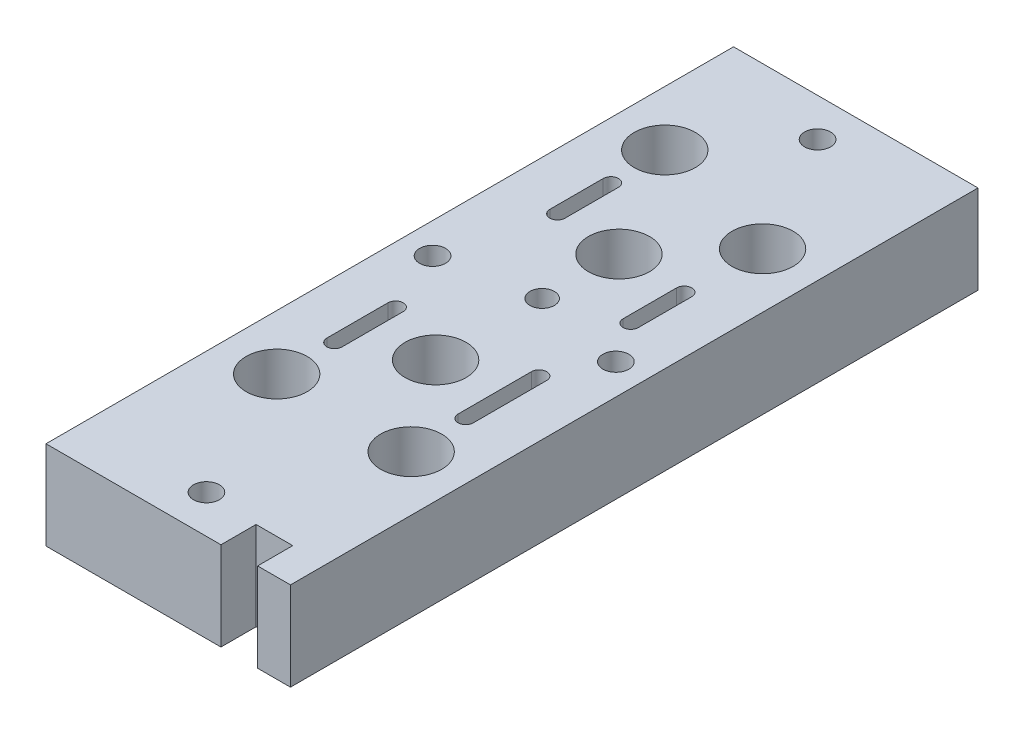
from build123d import *

# Parameters (mm, degrees)
SKETCH1_W           = 80
SKETCH1_H           = 225
BOSS_EXTRUDE1_DEPTH = 29
CUT_EXTRUDE1_REACH  = 124.871
SKETCH4_R           = 10
CUT_EXTRUDE2_DEPTH  = 17
SKETCH5_R           = 8.5
CUT_EXTRUDE3_DEPTH  = 5
CUT_EXTRUDE4_REACH  = 124.871
SKETCH6_W           = 12
SKETCH6_H           = 11.5
M10_TAPPED_HOLE1_D  = 8.5
CUT_EXTRUDE5_REACH  = 124.871
SKETCH10_R          = 4


with BuildPart() as part:
    # Sketch1 → Boss-Extrude1 (new body)
    with BuildSketch(Plane(origin=(0, 0, 0), x_dir=(1, 0, 0), z_dir=(0, 1, 0))):
        Rectangle(SKETCH1_W, SKETCH1_H)
    extrude(amount=-BOSS_EXTRUDE1_DEPTH)

    # Sketch2 → Cut-Extrude1 (cut, up to next)
    with BuildSketch(Plane(origin=(0, 0, 0), x_dir=(1, 0, 0), z_dir=(0, 1, 0)), mode=Mode.PRIVATE) as cut_extrude1_sk1:
        with BuildLine():
            Line((-19, 36.36), (-19, 53.86))
            ThreePointArc((-19, 53.86), (-21.5, 56.36), (-24, 53.86))
            Line((-24, 53.86), (-24, 36.36))
            ThreePointArc((-24, 36.36), (-21.5, 33.86), (-19, 36.36))
        make_face()
    cut_extrude1_tool1 = extrude(cut_extrude1_sk1.sketch, amount=-CUT_EXTRUDE1_REACH, mode=Mode.PRIVATE) & part.part
    # Sketch2 → Cut-Extrude1 (cut, up to next)
    with BuildSketch(Plane(origin=(0, 0, 0), x_dir=(1, 0, 0), z_dir=(0, 1, 0)), mode=Mode.PRIVATE) as cut_extrude1_sk2:
        with BuildLine():
            Line((-19, -36.59), (-19, -16.59))
            ThreePointArc((-19, -16.59), (-21.5, -14.09), (-24, -16.59))
            Line((-24, -16.59), (-24, -36.59))
            ThreePointArc((-24, -36.59), (-21.5, -39.09), (-19, -36.59))
        make_face()
    cut_extrude1_tool2 = extrude(cut_extrude1_sk2.sketch, amount=-CUT_EXTRUDE1_REACH, mode=Mode.PRIVATE) & part.part
    # Sketch2 → Cut-Extrude1 (cut, up to next)
    with BuildSketch(Plane(origin=(0, 0, 0), x_dir=(1, 0, 0), z_dir=(0, 1, 0)), mode=Mode.PRIVATE) as cut_extrude1_sk3:
        with BuildLine():
            Line((24, 17.36), (24, 34.86))
            ThreePointArc((24, 34.86), (21.5, 37.36), (19, 34.86))
            Line((19, 34.86), (19, 17.36))
            ThreePointArc((19, 17.36), (21.5, 14.86), (24, 17.36))
        make_face()
    cut_extrude1_tool3 = extrude(cut_extrude1_sk3.sketch, amount=-CUT_EXTRUDE1_REACH, mode=Mode.PRIVATE) & part.part
    # Sketch2 → Cut-Extrude1 (cut, up to next)
    with BuildSketch(Plane(origin=(0, 0, 0), x_dir=(1, 0, 0), z_dir=(0, 1, 0)), mode=Mode.PRIVATE) as cut_extrude1_sk4:
        with BuildLine():
            Line((24, -36.64), (24, -12.64))
            ThreePointArc((24, -12.64), (21.5, -10.14), (19, -12.64))
            Line((19, -12.64), (19, -36.64))
            ThreePointArc((19, -36.64), (21.5, -39.14), (24, -36.64))
        make_face()
    cut_extrude1_tool4 = extrude(cut_extrude1_sk4.sketch, amount=-CUT_EXTRUDE1_REACH, mode=Mode.PRIVATE) & part.part
    add(cut_extrude1_tool1.solids().sort_by_distance((-21.5, 0, -45.11))[0], mode=Mode.SUBTRACT)
    add(cut_extrude1_tool2.solids().sort_by_distance((-21.5, 0, 26.59))[0], mode=Mode.SUBTRACT)
    add(cut_extrude1_tool3.solids().sort_by_distance((21.5, 0, -26.11))[0], mode=Mode.SUBTRACT)
    add(cut_extrude1_tool4.solids().sort_by_distance((21.5, 0, 24.64))[0], mode=Mode.SUBTRACT)

    # Sketch4 → Cut-Extrude2 (cut)
    with BuildSketch(Plane(origin=(0, 0, 0), x_dir=(1, 0, 0), z_dir=(0, 1, 0))):
        with Locations((-22, 72)):
            Circle(SKETCH4_R)
        with Locations((22, 60)):
            Circle(SKETCH4_R)
        with Locations((0, 35)):
            Circle(SKETCH4_R)
        with Locations((0, -25)):
            Circle(SKETCH4_R)
        with Locations((22, -55)):
            Circle(SKETCH4_R)
        with Locations((-22, -55)):
            Circle(SKETCH4_R)
    extrude(amount=-CUT_EXTRUDE2_DEPTH, mode=Mode.SUBTRACT)

    # Sketch5 → Cut-Extrude3 (cut)
    with BuildSketch(Plane.XZ.offset(29)):
        with Locations((0, 100)):
            Circle(SKETCH5_R)
        with Locations((0, -100)):
            Circle(SKETCH5_R)
    extrude(amount=-CUT_EXTRUDE3_DEPTH, mode=Mode.SUBTRACT)

    # Sketch6 → Cut-Extrude4 (cut, up to next)
    with BuildSketch(Plane(origin=(0, 0, 0), x_dir=(1, 0, 0), z_dir=(0, 1, 0)), mode=Mode.PRIVATE) as cut_extrude4_sk1:
        with Locations((23.25, -106.75)):
            Rectangle(SKETCH6_W, SKETCH6_H)
    cut_extrude4_tool1 = extrude(cut_extrude4_sk1.sketch, amount=-CUT_EXTRUDE4_REACH, mode=Mode.PRIVATE) & part.part
    add(cut_extrude4_tool1.solids().sort_by_distance((23.25, 0, 106.75))[0], mode=Mode.SUBTRACT)

    # M10 Tapped Hole1 (through all)
    with Locations(Plane(origin=(0, 0, 0), x_dir=(1, 0, 0), z_dir=(0, 1, 0))):
        with Locations((0, -100), (30, 4), (-30, 4), (0, 100)):
            Hole(M10_TAPPED_HOLE1_D / 2)

    # Sketch10 → Cut-Extrude5 (cut, up to next)
    with BuildSketch(Plane(origin=(0, 0, 0), x_dir=(1, 0, 0), z_dir=(0, 1, 0)), mode=Mode.PRIVATE) as cut_extrude5_sk1:
        with Locations((0, 9.86)):
            Circle(SKETCH10_R)
    cut_extrude5_tool1 = extrude(cut_extrude5_sk1.sketch, amount=-CUT_EXTRUDE5_REACH, mode=Mode.PRIVATE) & part.part
    add(cut_extrude5_tool1.solids().sort_by_distance((0, 0, -9.86))[0], mode=Mode.SUBTRACT)


solid = part.part
